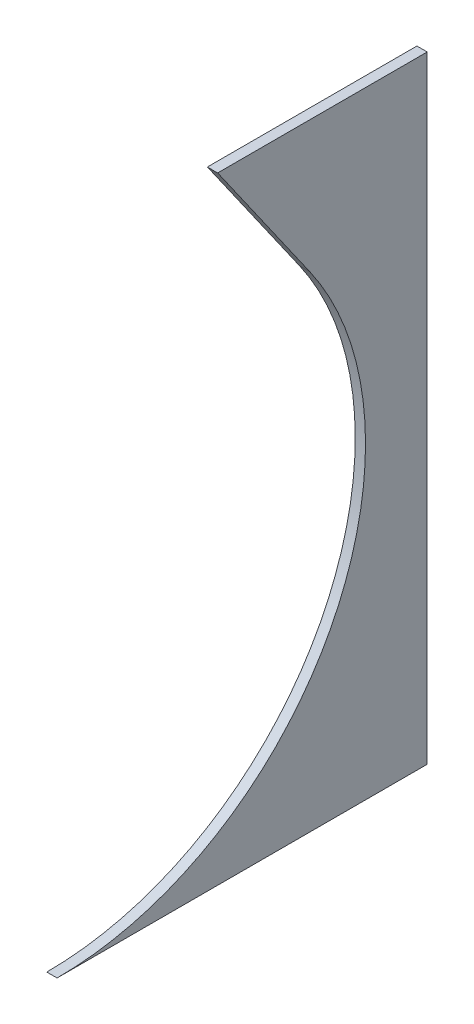
from build123d import *

# Parameters (mm, degrees)
SKETCH1_W           = 228.6
SKETCH1_H           = 381
BOSS_EXTRUDE1_DEPTH = 6.35
SKETCH2_R           = 190.5
CUT_EXTRUDE1_DEPTH  = 260.263586915
CUT_EXTRUDE2_DEPTH  = 260.263586915


with BuildPart() as part:
    # Sketch1 → Boss-Extrude1 (new body)
    with BuildSketch(Plane(origin=(0, 0, 0), x_dir=(0, 0, -1), z_dir=(1, 0, 0))):
        with Locations((19.05, 31.75)):
            Rectangle(SKETCH1_W, SKETCH1_H)
    extrude(amount=BOSS_EXTRUDE1_DEPTH)

    # Sketch2 → Cut-Extrude1 (cut, through all)
    with BuildSketch(Plane(origin=(6.35, 0, 0), x_dir=(0, 0, -1), z_dir=(1, 0, 0))):
        with Locations((-95.25, 31.75)):
            Circle(SKETCH2_R)
    extrude(amount=-CUT_EXTRUDE1_DEPTH, mode=Mode.SUBTRACT)

    # Sketch3 → Cut-Extrude2 (cut, through all)
    with BuildSketch(Plane(origin=(6.35, 0, 0), x_dir=(0, 0, -1), z_dir=(1, 0, 0))):
        Polygon((60.798464437, 141.016311125), (-14.580708336, 248.66892647), (-203.446235094, 248.66892647), (-203.446235094, 141.016311125), align=None)
    extrude(amount=-CUT_EXTRUDE2_DEPTH, mode=Mode.SUBTRACT)


solid = part.part
